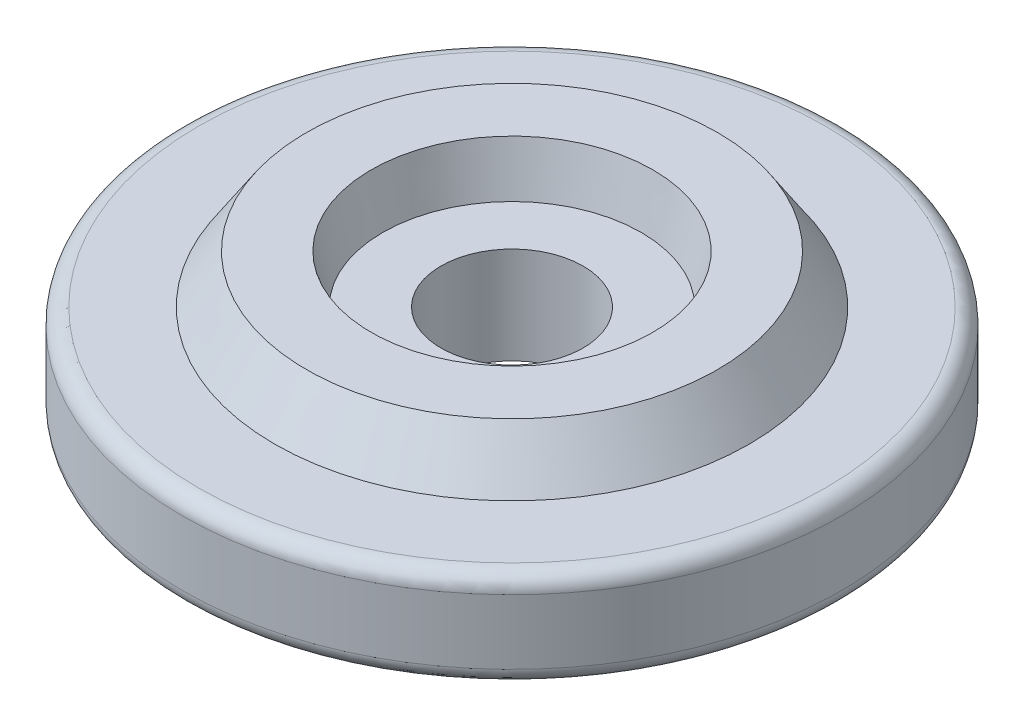
from build123d import *


with BuildPart() as part:
    # Sketch1 → Revolve1 (revolve)
    with BuildSketch(Plane.XY):
        with BuildLine():
            Line((2.2, 0), (2.2, 3))
            Line((2.2, 3), (4, 3))
            Line((4, 3), (4.359369746, 4.5))
            Line((4.359369746, 4.5), (6.359369746, 4.5))
            Line((6.359369746, 4.5), (7.347987035, 3))
            Line((7.347987035, 3), (9.7, 3))
            ThreePointArc((9.7, 3), (10.053553391, 2.853553391), (10.2, 2.5))
            Line((10.2, 2.5), (10.2, 0.5))
            ThreePointArc((10.2, 0.5), (10.053553391, 0.146446609), (9.7, 0))
            Line((9.7, 0), (2.2, 0))
        make_face()
    revolve(axis=Axis((0, 0, 0), (0, 1, 0)))


solid = part.part
